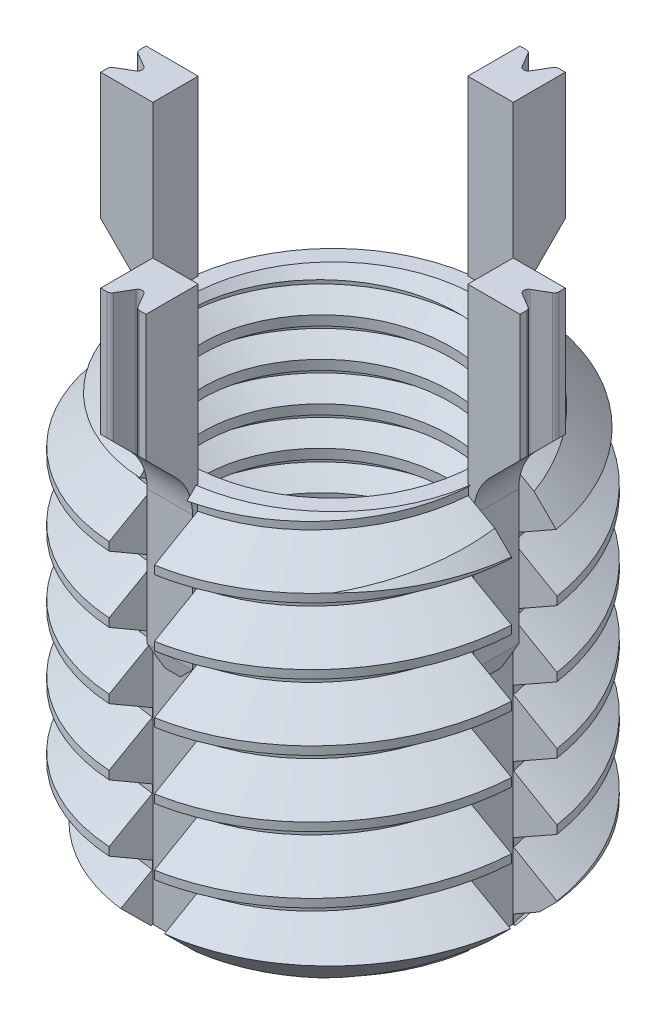
from build123d import *

# Parameters (mm, degrees)
SKETCH3_R                = 5.5626
EXTRUDE1_DEPTH           = 11.0998
SKETCH6_R                = 3.9751
EXTRUDE3_DEPTH           = 14.604800534
CHAMFER1_SIZE            = 1.133928571
EXTRUDE2_DEPTH           = 14.604800534
CIRPATTERN1_COUNT        = 4
EXTRUDE6_DEPTH           = 4.75615
EXTRUDE6_DEPTH_BACK      = 4.75615
SKETCH12_W               = 0.155915178
SKETCH12_H               = 1.247321428
SKETCH13_W               = 1.276614234
SKETCH13_H               = 1.247321428
EXTRUDE7_DEPTH           = 4.75615
CUT_EXTRUDE1_DEPTH       = 4.75615
FILLET1_R                = 0.124732143
EXTRUDE8_DEPTH           = 14.672060281
EXTRUDE8_DEPTH_BACK      = 14.672060281
EXTRUDE9_DEPTH           = 16.936045434
CUT_EXTRUDE2_DEPTH       = 1.247321
FILLET2_R                = 1.5875
CIRPATTERN2_COUNT        = 4
CUT_SWEEP1_PITCH         = 1.814285714
SWEEP1_PITCH             = 1.058333333
SKETCH9_R                = 3.9751
EXTRUDE4_OTHER_WAY_DEPTH = 15.634091456
EXTRUDE4_OTHER_WAY_TAPER = -45
SKETCH10_R               = 3.9751
EXTRUDE5_OTHER_WAY_DEPTH = 18.825357299
EXTRUDE5_OTHER_WAY_TAPER = -45


with BuildPart() as part:
    # Sketch3 → Extrude1 (new body)
    with BuildSketch(Plane(origin=(0, 0, 0), x_dir=(1, 0, 0), z_dir=(0, 1, 0))):
        with Locations(Location((0, 0, 0), (0, 0, 270))):
            Circle(SKETCH3_R)
    extrude(amount=-EXTRUDE1_DEPTH)

    # Sketch6 → Extrude3 (cut, through all)
    with BuildSketch(Plane(origin=(0, 0, 0), x_dir=(1, 0, 0), z_dir=(0, 1, 0))):
        with Locations(Location((0, 0, 0), (0, 0, 270))):
            Circle(SKETCH6_R)
    extrude(amount=-EXTRUDE3_DEPTH, mode=Mode.SUBTRACT)

    # Chamfer1
    chamfer1_edges = [part.edges().sort_by_distance(p)[0] for p in [
        (0, 0, -5.5626),
        (0, -11.0998, -5.5626),
    ]]
    chamfer(chamfer1_edges, length=CHAMFER1_SIZE)

    # Sketch11 → Extrude2 (cut, through all)
    with BuildSketch(Plane(origin=(0, 0, 0), x_dir=(1, 0, 0), z_dir=(0, 1, 0))):
        Polygon((-5.5626, 0.623660714), (-4.482387956, 0.623660714), (-4.326472778, 0.623660714), (-4.326472778, -0.623660714), (-4.482387956, -0.623660714), (-5.5626, -0.623660714), align=None)
    extrude2 = extrude(amount=-EXTRUDE2_DEPTH, mode=Mode.SUBTRACT)

    # CirPattern1: Extrude2 ×4 about axis
    cirpattern1_axis = Axis((0, 0, 0), (0, 1, 0))
    for i in range(1, CIRPATTERN1_COUNT):
        add(extrude2.rotate(cirpattern1_axis, i * 360 / CIRPATTERN1_COUNT), mode=Mode.SUBTRACT)

    # Cut-Sweep1: the profile of Sketch17 screwed along a right-hand helix of 7.118 turns, 10 arcs to a turn; built about Z, then put on its axis
    cut_sweep1_z = Axis((0, 0, 0), (0, 0, 1))
    cut_sweep1_corners = [(5.660801095, 0, -1.644196429), (5.660801095, 0, 0.056696429), (4.384186861, 0, -0.680357143), (4.384186861, 0, -0.907142857)]
    with BuildLine(mode=Mode.PRIVATE) as cut_sweep1_profile:
        Line(cut_sweep1_corners[0], cut_sweep1_corners[1])
        Line(cut_sweep1_corners[1], cut_sweep1_corners[2])
        Line(cut_sweep1_corners[2], cut_sweep1_corners[3])
        Line(cut_sweep1_corners[3], cut_sweep1_corners[0])
    cut_sweep1_cap = Face(cut_sweep1_profile.wire())
    cut_sweep1_turn_angles = [0, 18, 36, 54, 72, 90, 108, 126, 144, 162, 180, 198, 216, 234, 252, 270, 288, 306, 324, 342, 360]
    cut_sweep1_turn_weights = [1, 0.9510565162951535, 1, 0.9510565162951535, 1, 0.9510565162951535, 1, 0.9510565162951535, 1, 0.9510565162951535, 1, 0.9510565162951535, 1, 0.9510565162951535, 1, 0.9510565162951535, 1, 0.9510565162951535, 1, 0.9510565162951535, 1]
    cut_sweep1_turn_rails = [Edge.make_bspline([Vector(p[0], p[1], 0).rotate(cut_sweep1_z, cut_sweep1_turn_angles[k]) / cut_sweep1_turn_weights[k] + Vector(0, 0, p[2] + CUT_SWEEP1_PITCH * cut_sweep1_turn_angles[k] / 360) for k in range(21)], [0, 0, 0, 1, 1, 2, 2, 3, 3, 4, 4, 5, 5, 6, 6, 7, 7, 8, 8, 9, 9, 10, 10, 10], 2, cut_sweep1_turn_weights) for p in cut_sweep1_corners]
    cut_sweep1_turn_sides = [Face.make_surface_from_curves(cut_sweep1_turn_rails[p[0]], cut_sweep1_turn_rails[p[1]]) for p in [(0, 1), (1, 2), (2, 3), (3, 0)]]
    cut_sweep1_last_angles = [2520, 2538, 2556, 2559.239999993, 2562.479999987]
    cut_sweep1_last_weights = [1, 0.9510565162951535, 1, 0.9984015501154908, 1]
    cut_sweep1_last_rails = [Edge.make_bspline([Vector(p[0], p[1], 0).rotate(cut_sweep1_z, cut_sweep1_last_angles[k]) / cut_sweep1_last_weights[k] + Vector(0, 0, p[2] + CUT_SWEEP1_PITCH * cut_sweep1_last_angles[k] / 360) for k in range(5)], [0, 0, 0, 1, 1, 2, 2, 2], 2, cut_sweep1_last_weights) for p in cut_sweep1_corners]
    cut_sweep1_last_sides = [Face.make_surface_from_curves(cut_sweep1_last_rails[p[0]], cut_sweep1_last_rails[p[1]]) for p in [(0, 1), (1, 2), (2, 3), (3, 0)]]
    cut_sweep1 = Plane(origin=(0, 0, 0), x_dir=(-1, 0, 0), z_dir=(0, -1, 0)) * Solid(Shell([*[p.moved(Location((0, 0, CUT_SWEEP1_PITCH * i))) for i in range(7) for p in cut_sweep1_turn_sides], *cut_sweep1_last_sides, cut_sweep1_cap, cut_sweep1_cap.rotate(cut_sweep1_z, 2562.479999987).moved(Location((0, 0, CUT_SWEEP1_PITCH * 2562.479999987 / 360)))]))
    add(cut_sweep1, mode=Mode.SUBTRACT)

    # Sweep1: the profile of Sketch8 profile screwed along a right-hand helix of 11.488 turns, 8 arcs to a turn; built about Z, then put on its axis
    sweep1_z = Axis((0, 0, 0), (0, 0, 1))
    sweep1_corners = [(3.9754, 0, -0.926214872), (3.9754, 0, 0.000173205), (3.40226028, 0, -0.330729167), (3.40226028, 0, -0.5953125)]
    with BuildLine(mode=Mode.PRIVATE) as sweep1_profile:
        Line(sweep1_corners[0], sweep1_corners[1])
        Line(sweep1_corners[1], sweep1_corners[2])
        Line(sweep1_corners[2], sweep1_corners[3])
        Line(sweep1_corners[3], sweep1_corners[0])
    sweep1_cap = Face(sweep1_profile.wire())
    sweep1_turn_angles = [0, 22.5, 45, 67.5, 90, 112.5, 135, 157.5, 180, 202.5, 225, 247.5, 270, 292.5, 315, 337.5, 360]
    sweep1_turn_weights = [1, 0.9238795325112867, 1, 0.9238795325112867, 1, 0.9238795325112867, 1, 0.9238795325112867, 1, 0.9238795325112867, 1, 0.9238795325112867, 1, 0.9238795325112867, 1, 0.9238795325112867, 1]
    sweep1_turn_rails = [Edge.make_bspline([Vector(p[0], p[1], 0).rotate(sweep1_z, sweep1_turn_angles[k]) / sweep1_turn_weights[k] + Vector(0, 0, p[2] + SWEEP1_PITCH * sweep1_turn_angles[k] / 360) for k in range(17)], [0, 0, 0, 1, 1, 2, 2, 3, 3, 4, 4, 5, 5, 6, 6, 7, 7, 8, 8, 8], 2, sweep1_turn_weights) for p in sweep1_corners]
    sweep1_turn_sides = [Face.make_surface_from_curves(sweep1_turn_rails[p[0]], sweep1_turn_rails[p[1]]) for p in [(0, 1), (1, 2), (2, 3), (3, 0)]]
    sweep1_last_angles = [3960, 3982.5, 4005, 4027.5, 4050, 4072.5, 4095, 4115.339999985, 4135.67999997]
    sweep1_last_weights = [1, 0.9238795325112867, 1, 0.9238795325112867, 1, 0.9238795325112867, 1, 0.9376464993888286, 1]
    sweep1_last_rails = [Edge.make_bspline([Vector(p[0], p[1], 0).rotate(sweep1_z, sweep1_last_angles[k]) / sweep1_last_weights[k] + Vector(0, 0, p[2] + SWEEP1_PITCH * sweep1_last_angles[k] / 360) for k in range(9)], [0, 0, 0, 1, 1, 2, 2, 3, 3, 4, 4, 4], 2, sweep1_last_weights) for p in sweep1_corners]
    sweep1_last_sides = [Face.make_surface_from_curves(sweep1_last_rails[p[0]], sweep1_last_rails[p[1]]) for p in [(0, 1), (1, 2), (2, 3), (3, 0)]]
    sweep1 = Plane(origin=(0, 0, 0), x_dir=(0, 0, 1), z_dir=(0, -1, 0)) * Solid(Shell([*[p.moved(Location((0, 0, SWEEP1_PITCH * i))) for i in range(11) for p in sweep1_turn_sides], *sweep1_last_sides, sweep1_cap, sweep1_cap.rotate(sweep1_z, 4135.67999997).moved(Location((0, 0, SWEEP1_PITCH * 4135.67999997 / 360)))]))
    add(sweep1)

    # Extrude4 cone 1 section (through the dimple's axis) → Extrude4 (revolve, cut)
    with BuildSketch(Plane(origin=(0, 0, 0), x_dir=(0, 0, 1), z_dir=(1, 0, 0))):
        Polygon((0, 0), (3.9751, 0), (0, 3.9751), align=None)
    revolve(axis=Axis((0, 0, 0), (0, -1, 0)), mode=Mode.SUBTRACT)

    # Sketch9 → Extrude4 other way (cut)
    with BuildSketch(Plane(origin=(0, 0, 0), x_dir=(1, 0, 0), z_dir=(0, 1, 0))):
        Circle(SKETCH9_R)
    extrude(amount=EXTRUDE4_OTHER_WAY_DEPTH, taper=EXTRUDE4_OTHER_WAY_TAPER, mode=Mode.SUBTRACT)

    # Extrude5 cone 1 section (through the dimple's axis) → Extrude5 (revolve, cut)
    with BuildSketch(Plane(origin=(0, -11.0998, 0), x_dir=(0, 0, -1), z_dir=(1, 0, 0))):
        Polygon((0, 0), (3.9751, 0), (0, 3.9751), align=None)
    revolve(axis=Axis((0, -11.0998, 0), (0, 1, 0)), mode=Mode.SUBTRACT)

    # Sketch10 → Extrude5 other way (cut)
    with BuildSketch(Plane.XZ.offset(11.0998)):
        Circle(SKETCH10_R)
    extrude(amount=EXTRUDE5_OTHER_WAY_DEPTH, taper=EXTRUDE5_OTHER_WAY_TAPER, mode=Mode.SUBTRACT)


with BuildPart() as body_2:
    # Sketch12 → Extrude6 (new, two sides: drawn at the far end of the back side and taken through both)
    with BuildSketch(Plane(origin=(0, 0, 0), x_dir=(1, 0, 0), z_dir=(0, 1, 0)).offset(-EXTRUDE6_DEPTH_BACK)):
        with Locations((-4.404430367, 0)):
            Rectangle(SKETCH12_W, SKETCH12_H)
    extrude(amount=EXTRUDE6_DEPTH + EXTRUDE6_DEPTH_BACK)

    # Sketch13 → Extrude7 (add)
    with BuildSketch(Plane(origin=(0, 4.75615, 0), x_dir=(1, 0, 0), z_dir=(0, 1, 0))):
        with Locations((-5.120695073, 0)):
            Rectangle(SKETCH13_W, SKETCH13_H)
    extrude(amount=-EXTRUDE7_DEPTH)

    # Sketch18 → Cut-Extrude1 (cut)
    with BuildSketch(Plane(origin=(0, 4.75615, 0), x_dir=(1, 0, 0), z_dir=(0, 1, 0))):
        Polygon((-5.75900219, 0.374196429), (-5.120695073, 0), (-5.75900219, -0.374196429), align=None)
    extrude(amount=-CUT_EXTRUDE1_DEPTH, mode=Mode.SUBTRACT)

    # Fillet1
    fillet1_edges = [body_2.edges().sort_by_distance(p)[0] for p in [
        (-5.75900219, 2.378075, 0.374196429),
        (-5.75900219, 2.378075, -0.374196429),
        (-5.120695073, 2.378075, 0),
    ]]
    fillet(fillet1_edges, radius=FILLET1_R)

    # Sketch14 → Extrude8 (cut, two sides: drawn at the far end of the back side and taken through both)
    with BuildSketch(Plane.XY.offset(-EXTRUDE8_DEPTH_BACK)):
        Polygon((-5.75900219, 0), (-5.75900219, 1.276614234), (-4.482387956, 0), align=None)
    extrude(amount=EXTRUDE8_DEPTH + EXTRUDE8_DEPTH_BACK, mode=Mode.SUBTRACT)

    # Sketch15 → Extrude9 (cut, through all)
    with BuildSketch(Plane.ZY.offset(4.482387956)):
        Polygon((-0.623660714, -4.75615), (-0.623660714, -4.344155952), (-0.211666667, -4.75615), align=None)
        Polygon((0.623660714, -4.75615), (0.623660714, -4.344155952), (0.211666667, -4.75615), align=None)
    extrude(amount=-EXTRUDE9_DEPTH, mode=Mode.SUBTRACT)

    # Sketch19 → Cut-Extrude2 (cut)
    with BuildSketch(Plane(origin=(0, 0, 0.623660714), x_dir=(-1, 0, 0), z_dir=(0, 0, -1))):
        Polygon((4.482387956, -4.344155952), (4.404430367, -4.75615), (4.482387956, -4.75615), align=None)
    extrude(amount=CUT_EXTRUDE2_DEPTH, mode=Mode.SUBTRACT)

    # Fillet2
    fillet2_edges = [body_2.edges().sort_by_distance(p)[0] for p in [
        (-4.482387956, 0, 0),
    ]]
    fillet(fillet2_edges, radius=FILLET2_R)


with BuildPart() as cirpattern2_1:
    # CirPattern2: pattern copy
    add(body_2.part.rotate(Axis((0, 0, 0), (0, 1, 0)), 1 * 360 / CIRPATTERN2_COUNT))


with BuildPart() as cirpattern2_2:
    # CirPattern2: pattern copy
    add(body_2.part.rotate(Axis((0, 0, 0), (0, 1, 0)), 2 * 360 / CIRPATTERN2_COUNT))


with BuildPart() as cirpattern2_3:
    # CirPattern2: pattern copy
    add(body_2.part.rotate(Axis((0, 0, 0), (0, 1, 0)), 3 * 360 / CIRPATTERN2_COUNT))


solid = Compound([part.part, body_2.part, cirpattern2_1.part, cirpattern2_2.part, cirpattern2_3.part])
